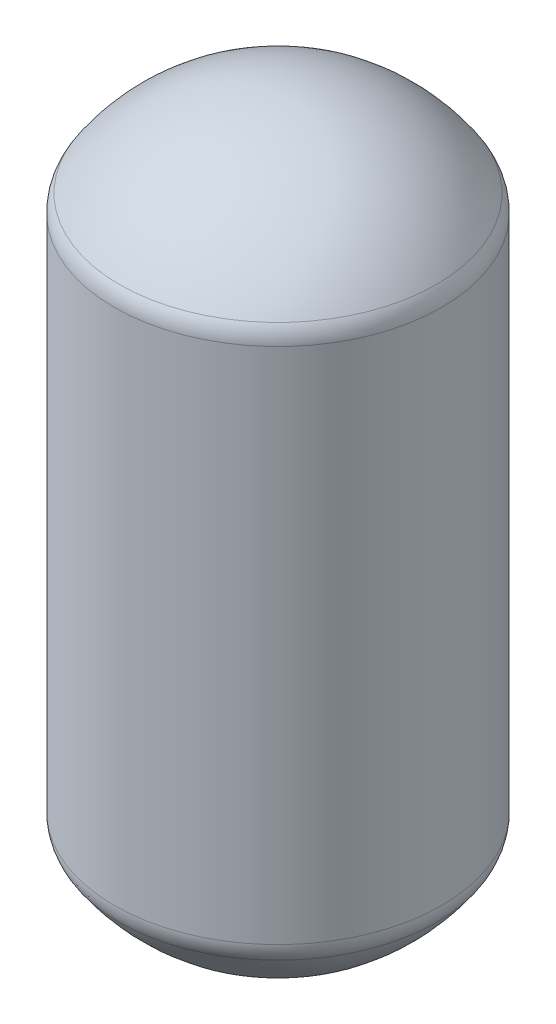
from build123d import *

# Parameters (mm, degrees)
FILLET1_R = 25.4


with BuildPart() as part:
    # Sketch1 → Revolve2 (revolve)
    with BuildSketch(Plane.XY):
        with BuildLine():
            ThreePointArc((0, 1200), (-77.068833235, 1179.617552605), (-133.985, 1123.8))
            Line((-133.985, 1123.8), (-133.985, 685.1))
            ThreePointArc((-133.985, 685.1), (-77.068833235, 629.282447395), (0, 608.9))
            Line((0, 608.9), (0, 612.075))
            ThreePointArc((0, 612.075), (-75.121348346, 631.828135015), (-130.81, 685.977718551))
            Line((-130.81, 685.977718551), (-130.81, 1122.922281449))
            ThreePointArc((-130.81, 1122.922281449), (-75.121348346, 1177.071864985), (0, 1196.825))
            Line((0, 1196.825), (0, 1200))
        make_face()
    revolve(axis=Axis((0, 0, 0), (0, 1, 0)))

    # Fillet1
    fillet1_edges = [part.edges().sort_by_distance(p)[0] for p in [
        (130.81, 685.977718551, 0),
        (133.985, 685.1, 0),
        (130.81, 1122.922281449, 0),
        (133.985, 1123.8, 0),
    ]]
    fillet(fillet1_edges, radius=FILLET1_R)


solid = part.part
